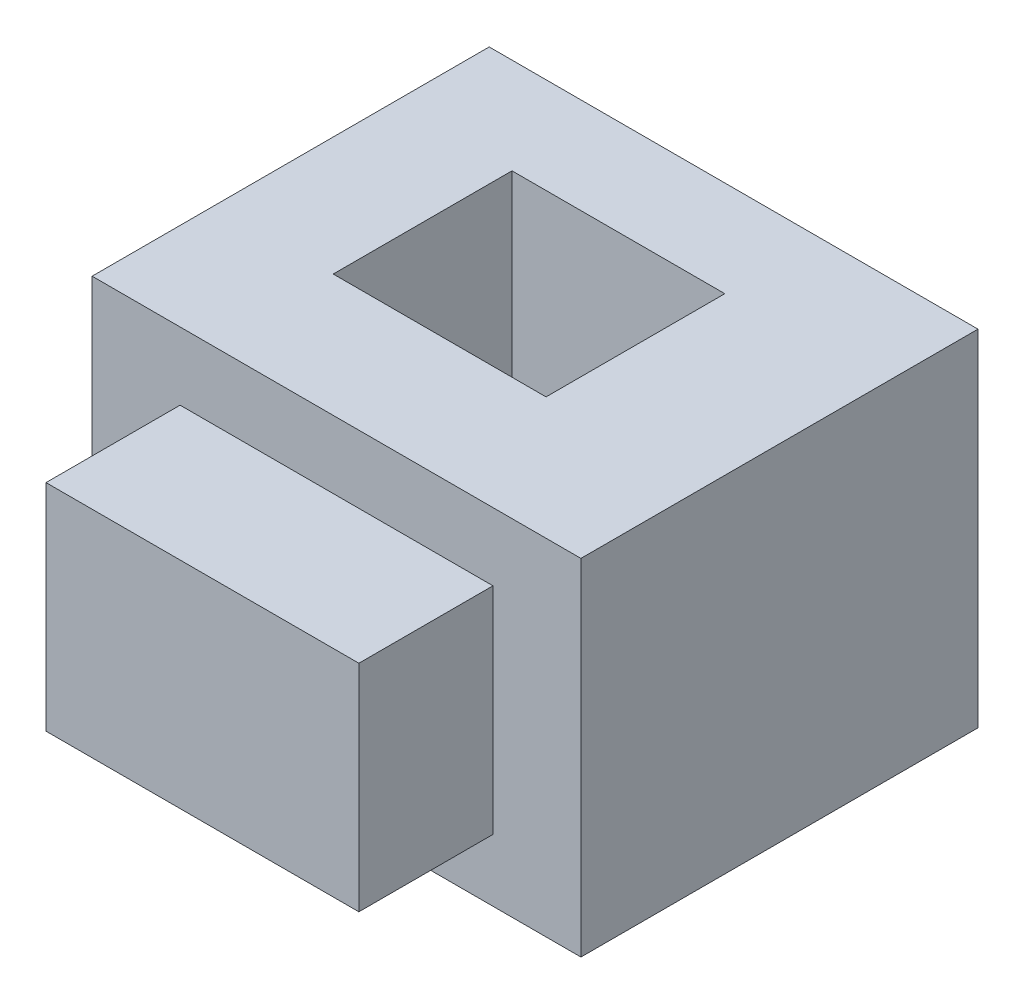
from build123d import *

# Parameters (mm, degrees)
SKETCH1_W           = 36.453071334
SKETCH1_H           = 29.61270878
BOSS_EXTRUDE1_DEPTH = 25.750300868
SKETCH3_W           = 23.333103548
SKETCH3_H           = 16.05594749
BOSS_EXTRUDE2_DEPTH = 10
SKETCH4_W           = 15.871036998
SKETCH4_H           = 13.331671078
CUT_EXTRUDE1_DEPTH  = 54.561337975


with BuildPart() as part:
    # Sketch1 → Boss-Extrude1 (new body)
    with BuildSketch(Plane(origin=(0, 0, 0), x_dir=(1, 0, 0), z_dir=(0, 1, 0))):
        with Locations((18.226535667, 14.80635439)):
            Rectangle(SKETCH1_W, SKETCH1_H)
    extrude(amount=BOSS_EXTRUDE1_DEPTH)

    # Sketch3 → Boss-Extrude2 (add)
    with BuildSketch(Plane.XY):
        with Locations((18.226535667, 12.671057518)):
            Rectangle(SKETCH3_W, SKETCH3_H)
    extrude(amount=BOSS_EXTRUDE2_DEPTH)

    # Sketch4 → Cut-Extrude1 (cut, through all)
    with BuildSketch(Plane(origin=(0, 25.750300868, 0), x_dir=(1, 0, 0), z_dir=(0, 1, 0))):
        with Locations((16.787561646, 15.795025684)):
            Rectangle(SKETCH4_W, SKETCH4_H)
    extrude(amount=-CUT_EXTRUDE1_DEPTH, mode=Mode.SUBTRACT)


solid = part.part
